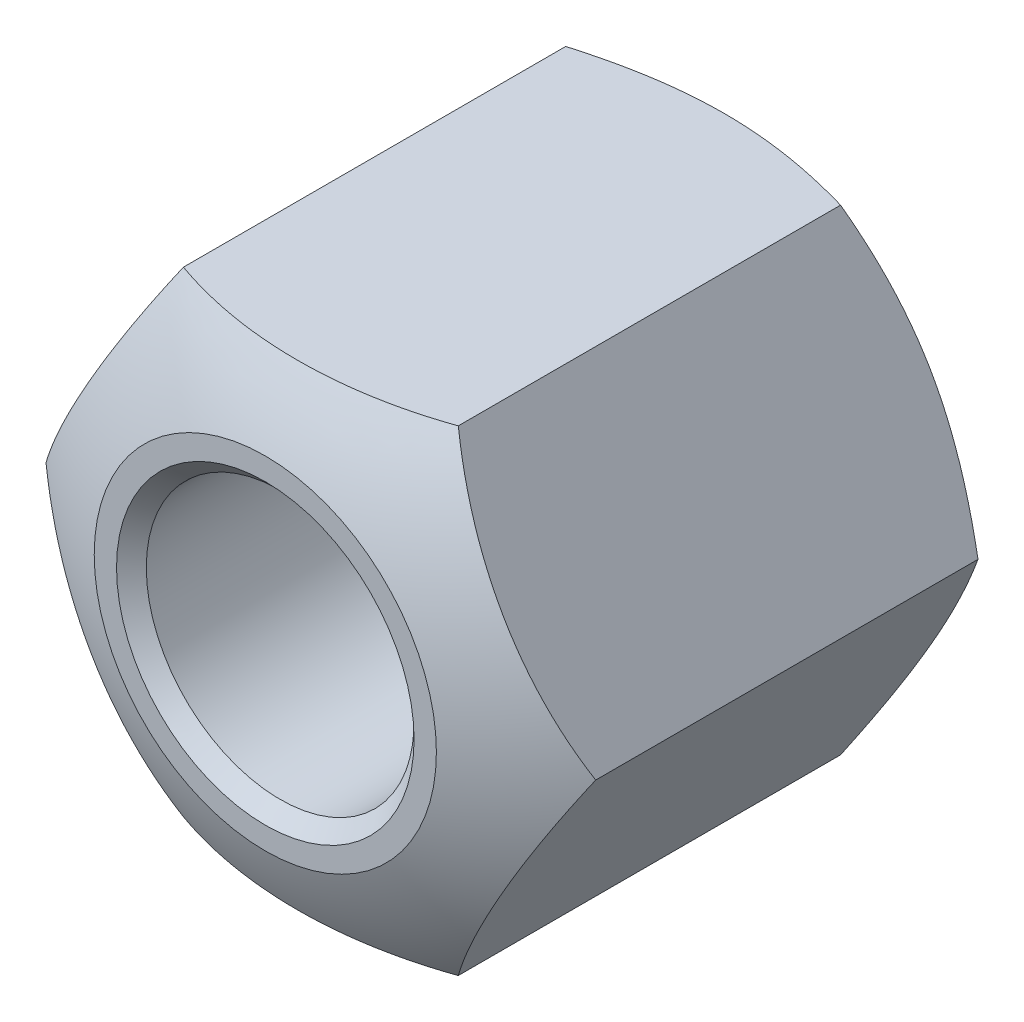
from build123d import *

# Parameters (mm, degrees)
SKETCH1_R     = 4.5
BASENUT_DEPTH = 16.35
CHAMFER1_SIZE = 0.5


with BuildPart() as part:
    # Sketch1 → BaseNut (new body)
    with BuildSketch(Plane.XY):
        Polygon((4.618802154, -8), (9.237604307, 0), (4.618802154, 8), (-4.618802154, 8), (-9.237604307, 0), (-4.618802154, -8), align=None)
        Circle(SKETCH1_R, mode=Mode.SUBTRACT)
    extrude(amount=-BASENUT_DEPTH)

    # Sketch2 → EndChamfer1 (revolve, cut)
    with BuildSketch(Plane(origin=(-4.377633457, 0, -4.85997085), x_dir=(0, 0, 1), z_dir=(0, 1, 0))):
        with BuildLine():
            Line((2.992824423, 13.615237764), (4.85997085, 13.615237764))
            Line((4.85997085, 13.615237764), (4.85997085, 10.127633457))
            ThreePointArc((4.85997085, 10.127633457), (4.03460032, 11.9293637), (2.992824423, 13.615237764))
        make_face()
    revolve(axis=Axis((0, 0, -14.951953209), (0, 0, 1)), mode=Mode.SUBTRACT)

    # Sketch3 → EndChamfer2 (revolve, cut)
    with BuildSketch(Plane(origin=(-4.618802154, 0, -4.618802154), x_dir=(0, 0, 1), z_dir=(0, 1, 0))):
        Polygon((-11.731197846, 11.02450339), (-11.731197846, 13.856406461), (-10.096197846, 13.856406461), align=None)
    revolve(axis=Axis((0, 0, 4.805328432), (0, 0, -1)), mode=Mode.SUBTRACT)

    # Chamfer1
    chamfer1_edges = [part.edges().sort_by_distance(p)[0] for p in [
        (-4.5, 0, 0),
        (-4.5, 0, -16.35),
    ]]
    chamfer(chamfer1_edges, length=CHAMFER1_SIZE)


solid = part.part
